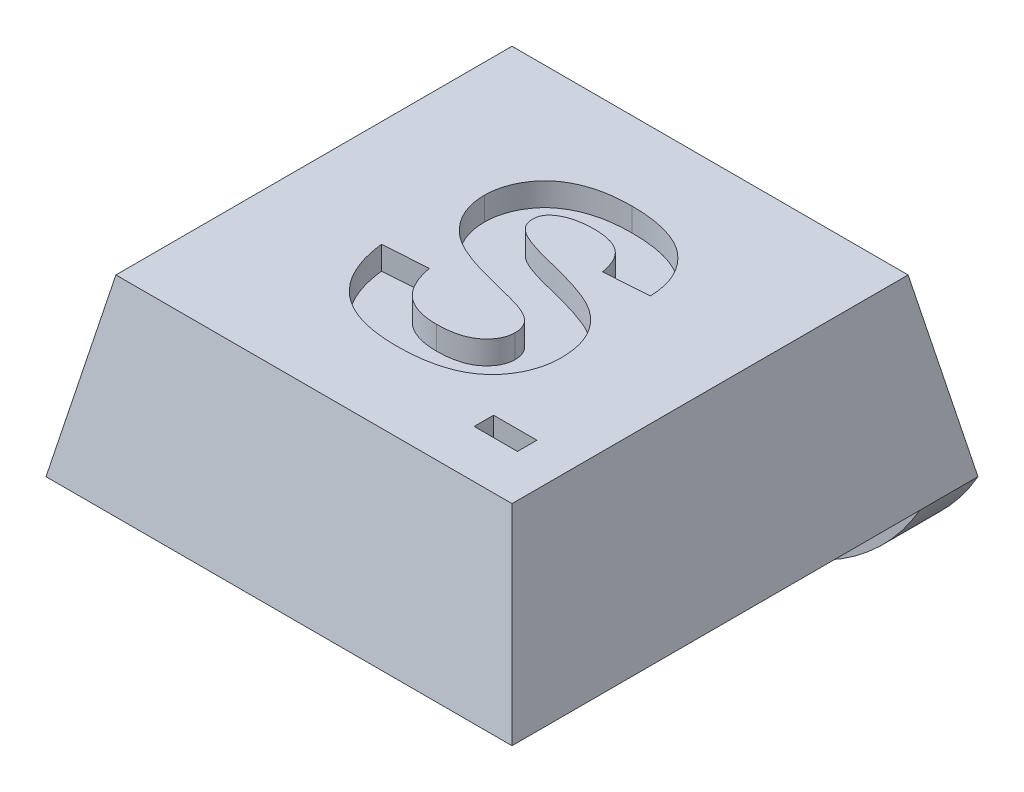
from build123d import *

# Parameters (mm, degrees)
SKETCH1_W               = 8
SKETCH1_H               = 8
BOSS_EXTRUDE1_DEPTH     = 3
CUT_EXTRUDE1_DEPTH      = 12.704699911
CUT_EXTRUDE1_DEPTH_BACK = 12.704699911
CUT_EXTRUDE2_DEPTH      = 11
SKETCH4_R               = 1.8
CUT_EXTRUDE3_DEPTH      = 0.8
SKETCH5_W               = 8
SKETCH5_H               = 1
BOSS_EXTRUDE2_DEPTH     = 2
FILLET1_R               = 4
CUT_EXTRUDE4_DEPTH      = 0.4
SKETCH7_W               = 0.743589743
SKETCH7_H               = 0.333333333
CUT_EXTRUDE5_DEPTH      = 0.4


with BuildPart() as part:
    # Sketch1 → Boss-Extrude1 (new body)
    with BuildSketch(Plane(origin=(0, 0, 0), x_dir=(1, 0, 0), z_dir=(0, 1, 0))):
        with Locations((4, 4)):
            Rectangle(SKETCH1_W, SKETCH1_H)
    extrude(amount=BOSS_EXTRUDE1_DEPTH)

    # Sketch2 → Cut-Extrude1 (cut, two sides: drawn at the far end of the back side and taken through both)
    with BuildSketch(Plane.XY.offset(-CUT_EXTRUDE1_DEPTH_BACK)):
        Polygon((0, 0), (0.6, 3), (0, 3), align=None)
        Polygon((8, 0), (7.4, 3), (8, 3), align=None)
    extrude(amount=CUT_EXTRUDE1_DEPTH + CUT_EXTRUDE1_DEPTH_BACK, mode=Mode.SUBTRACT)

    # Sketch3 → Cut-Extrude2 (cut)
    with BuildSketch(Plane(origin=(0, 0, 0), x_dir=(0, 0, -1), z_dir=(1, 0, 0))):
        Polygon((0, 0), (0.6, 3), (0, 3), align=None)
        Polygon((8, 3), (7.4, 3), (8, 0), align=None)
    extrude(amount=CUT_EXTRUDE2_DEPTH, mode=Mode.SUBTRACT)

    # Sketch4 → Cut-Extrude3 (cut)
    with BuildSketch(Plane.XZ):
        with Locations(Location((4, -3.75, 0), (0, 0, 270))):
            Circle(SKETCH4_R)
    extrude(amount=-CUT_EXTRUDE3_DEPTH, mode=Mode.SUBTRACT)

    # Sketch5 → Boss-Extrude2 (add)
    with BuildSketch(Plane.XZ):
        with Locations((4, -7.5)):
            Rectangle(SKETCH5_W, SKETCH5_H)
    extrude(amount=BOSS_EXTRUDE2_DEPTH)

    # Fillet1
    # the kernel refuses this fillet: 4 mm, written as the material it takes off along each edge
    with BuildSketch(Plane(origin=(8, -2, -16.660254038), x_dir=(0, 1, 0), z_dir=(0, 0, 1)), Plane(origin=(0, -2, 1.660254038), x_dir=(0, 1, 0), z_dir=(0, 0, -1))) as fillet1_piece_1:
        with BuildLine():
            CenterArc((4, 3.464101615), FILLET1_R, 180, 60)
            Line((0, 3.464101615), (-0.08, 3.464101615))
            Line((-0.08, 3.464101615), (-0.08, 0))
            Line((-0.08, 0), (0, -0.08))
            ThreePointArc((0, -0.08), (1, -0.08), (1.96, -0.069282032))
            Line((1.96, -0.069282032), (2, 0))
        make_face()
    extrude(amount=18.320508076, mode=Mode.SUBTRACT)

    # Sketch6 → Cut-Extrude4 (cut)
    with BuildSketch(Plane(origin=(0, 3, 0), x_dir=(1, 0, 0), z_dir=(0, 1, 0))):
        with BuildLine():
            Line((2.423916505, 3.336189685), (3.193147274, 3.387471736))
            add(Edge.make_bspline(
                [(3.193147274, 3.387471736), (3.199275518, 3.35528983), (3.211179242, 3.292778523), (3.237627081, 3.203691377), (3.266738832, 3.12063689), (3.30152897, 3.044505684), (3.339615284, 2.973890515), (3.38412658, 2.910803039), (3.431957638, 2.853229033), (3.485476185, 2.803236311), (3.543783948, 2.759451994), (3.607171876, 2.722111271), (3.674953108, 2.6897922), (3.747293374, 2.663178469), (3.824938253, 2.64331119), (3.907211345, 2.629176798), (3.994230643, 2.620125524), (4.053701404, 2.618879435), (4.084172915, 2.618240967)],
                knots=[0, 0, 0, 0, 1.204560339, 2.339781841, 3.415289417, 4.440034832, 5.416475564, 6.362424008, 7.275913008, 8.16578645, 9.05021719, 9.95355393, 10.867835453, 11.809845306, 12.784702352, 13.812224031, 14.87903166, 16, 16, 16, 16], degree=3))
            add(Edge.make_bspline(
                [(4.084172915, 2.618240967), (4.116246108, 2.618590883), (4.178630121, 2.619271489), (4.269031453, 2.627715), (4.353560804, 2.639811238), (4.431471751, 2.6589593), (4.504219207, 2.680373377), (4.569996427, 2.709670116), (4.629867843, 2.743459668), (4.683679212, 2.781802056), (4.730640445, 2.824326515), (4.771724475, 2.86872067), (4.807505951, 2.914025405), (4.835668504, 2.962251146), (4.858460082, 3.011447443), (4.873523718, 3.063081907), (4.883700097, 3.1159689), (4.884867031, 3.152113555), (4.885454967, 3.1703243)],
                knots=[0, 0, 0, 0, 1.417779877, 2.757654889, 4.012140507, 5.189587551, 6.302846416, 7.360586765, 8.365575446, 9.33904572, 10.275781718, 11.161696098, 12.012180333, 12.822428111, 13.625933072, 14.403138519, 15.195454004, 16, 16, 16, 16], degree=3))
            add(Edge.make_bspline(
                [(4.885454967, 3.1703243), (4.884733913, 3.193140887), (4.883323278, 3.237778199), (4.866340641, 3.301592127), (4.840872442, 3.360713887), (4.802526135, 3.41427025), (4.750979261, 3.463212961), (4.685226085, 3.508997669), (4.603431212, 3.550186), (4.542750055, 3.573160928), (4.510454967, 3.585388403)],
                knots=[0, 0, 0, 0, 0.90494901, 1.770400303, 2.607161909, 3.452839393, 4.36912122, 5.420987164, 6.627424851, 8, 8, 8, 8], degree=3))
            add(Edge.make_bspline(
                [(4.510454967, 3.585388403), (4.496597999, 3.590031937), (4.465588357, 3.600423411), (4.4126892, 3.615282239), (4.348970759, 3.633836968), (4.273512264, 3.654927379), (4.186339087, 3.676497317), (4.088424838, 3.703069034), (3.978575834, 3.729510064), (3.901725338, 3.749028827), (3.861416505, 3.759266608)],
                knots=[0, 0, 0, 0, 0.521821638, 1.167752076, 1.961721917, 2.891982557, 3.96540661, 5.168436773, 6.514817513, 8, 8, 8, 8], degree=3))
            add(Edge.make_bspline(
                [(3.861416505, 3.759266608), (3.808922441, 3.772373151), (3.707643728, 3.797660082), (3.563197092, 3.84264374), (3.430159098, 3.887337495), (3.309810688, 3.935832618), (3.200824367, 3.984842463), (3.104963023, 4.037807847), (3.02022624, 4.091978089), (2.970848149, 4.132466251), (2.947153685, 4.151894813)],
                knots=[0, 0, 0, 0, 1.293880989, 2.496331788, 3.617634808, 4.64976062, 5.598842568, 6.473791081, 7.267636666, 8, 8, 8, 8], degree=3))
            add(Edge.make_bspline(
                [(2.947153685, 4.151894813), (2.917769469, 4.179407128), (2.860158996, 4.233347566), (2.784323751, 4.321982057), (2.720601495, 4.415610216), (2.668151102, 4.513540942), (2.627765291, 4.616338017), (2.599140348, 4.723313361), (2.580613245, 4.834746169), (2.578722682, 4.91063455), (2.577762659, 4.949170454)],
                knots=[0, 0, 0, 0, 1.064429417, 2.086912298, 3.078678339, 4.055528992, 5.020032834, 5.993708893, 6.981211098, 8, 8, 8, 8], degree=3))
            add(Edge.make_bspline(
                [(2.577762659, 4.949170454), (2.579632311, 4.999035454), (2.583341142, 5.097952729), (2.617353538, 5.24334762), (2.670335558, 5.383642492), (2.731782138, 5.495041815), (2.790819043, 5.579315825), (2.839844896, 5.639790083), (2.893704531, 5.696388175), (2.953135712, 5.747729494), (3.015931612, 5.796821395), (3.084525186, 5.840415592), (3.156971597, 5.881478913), (3.261809808, 5.93015757), (3.404151332, 5.980885512), (3.589345301, 6.023645948), (3.790984862, 6.049350493), (3.930782191, 6.052503897), (4.003243428, 6.054138403)],
                knots=[0, 0, 0, 0, 1.180131776, 2.341029169, 3.518901375, 4.725685298, 5.343762192, 5.955650671, 6.568945152, 7.192346361, 7.815201106, 8.455999361, 9.116257477, 9.787318263, 11.192748436, 12.688084276, 14.283332633, 16, 16, 16, 16], degree=3))
            add(Edge.make_bspline(
                [(4.003243428, 6.054138403), (4.062574751, 6.053344994), (4.177972905, 6.051801831), (4.345255933, 6.036197125), (4.501507358, 6.011910245), (4.646178875, 5.977046542), (4.779337891, 5.930982439), (4.901500568, 5.876111383), (5.012563098, 5.81096567), (5.111173405, 5.735171454), (5.199025737, 5.651613191), (5.275662846, 5.560343317), (5.341377732, 5.462514514), (5.396594511, 5.358198276), (5.439956101, 5.246858263), (5.471803478, 5.128633406), (5.492867609, 5.003801978), (5.498147397, 4.918266237), (5.500839582, 4.874651223)],
                knots=[0, 0, 0, 0, 1.325124071, 2.577337985, 3.749592149, 4.855247722, 5.896868755, 6.892903601, 7.842551483, 8.766257401, 9.665194363, 10.546067736, 11.423174165, 12.293291263, 13.177512979, 14.086532529, 15.024315359, 16, 16, 16, 16], degree=3))
            Line((5.500839582, 4.874651223), (4.731608813, 4.823369172))
            add(Edge.make_bspline(
                [(4.731608813, 4.823369172), (4.727171315, 4.847490186), (4.718523093, 4.894499533), (4.699719489, 4.96182647), (4.678509937, 5.024096207), (4.653685255, 5.081308344), (4.623700039, 5.13243816), (4.591067506, 5.179094223), (4.554887475, 5.220654869), (4.51396201, 5.255982033), (4.469697485, 5.288128305), (4.419251527, 5.313894286), (4.364737876, 5.337799444), (4.30408262, 5.355770261), (4.238450559, 5.370025359), (4.167803464, 5.380593162), (4.091994892, 5.385752959), (4.039841388, 5.386885694), (4.012858813, 5.387471736)],
                knots=[0, 0, 0, 0, 1.151066407, 2.24330871, 3.278475654, 4.238599069, 5.165719782, 6.056502506, 6.909492653, 7.744782051, 8.590364415, 9.471203867, 10.39832458, 11.382154319, 12.435022857, 13.550631277, 14.73277401, 16, 16, 16, 16], degree=3))
            add(Edge.make_bspline(
                [(4.012858813, 5.387471736), (3.984804304, 5.386954358), (3.930223002, 5.385947775), (3.850683499, 5.379770524), (3.776069477, 5.368367912), (3.706014485, 5.353524542), (3.640612102, 5.333331162), (3.580000346, 5.308708643), (3.523901913, 5.279720359), (3.489695535, 5.256913378), (3.47279471, 5.245644813)],
                knots=[0, 0, 0, 0, 1.186678824, 2.308736671, 3.37120409, 4.377216403, 5.334874112, 6.262130804, 7.141346615, 8, 8, 8, 8], degree=3))
            add(Edge.make_bspline(
                [(3.47279471, 5.245644813), (3.453453136, 5.230251633), (3.415994509, 5.200439822), (3.3756811, 5.141243702), (3.351412335, 5.074383458), (3.348491314, 5.027102037), (3.346993428, 5.002856352)],
                knots=[0, 0, 0, 0, 1.037857257, 2.010007357, 2.979541333, 4, 4, 4, 4], degree=3))
            add(Edge.make_bspline(
                [(3.346993428, 5.002856352), (3.348218426, 4.980197149), (3.350631475, 4.935562125), (3.374970191, 4.872157107), (3.41239982, 4.813407798), (3.447371668, 4.781494404), (3.465583172, 4.764875582)],
                knots=[0, 0, 0, 0, 0.98538058, 1.941042925, 2.927803204, 4, 4, 4, 4], degree=3))
            add(Edge.make_bspline(
                [(3.465583172, 4.764875582), (3.480036346, 4.754089134), (3.512333176, 4.72998591), (3.571494566, 4.699348433), (3.642903916, 4.666166195), (3.728189187, 4.633726893), (3.826783574, 4.601347807), (3.938693075, 4.567540299), (4.063986517, 4.533278892), (4.199470233, 4.500098399), (4.337024364, 4.467483879), (4.46828848, 4.431827004), (4.590345232, 4.397064309), (4.702628677, 4.360627363), (4.805717615, 4.325156109), (4.899111277, 4.288724577), (4.98345094, 4.253244341), (5.081800337, 4.204456503), (5.193269487, 4.138371404), (5.310101731, 4.042305693), (5.413424942, 3.934321559), (5.485417809, 3.83249997), (5.534873142, 3.744930694), (5.566717158, 3.675127784), (5.59426473, 3.601573118), (5.616688379, 3.524185412), (5.632940128, 3.442855773), (5.646389397, 3.358205559), (5.653260877, 3.269531733), (5.654205671, 3.209062493), (5.654685736, 3.178337121)],
                knots=[0, 0, 0, 0, 0.511875881, 1.143829537, 1.88775736, 2.750598373, 3.734912702, 4.837306479, 6.073130119, 7.42648979, 8.801963576, 10.091065733, 11.292408984, 12.408830014, 13.446061236, 14.39066453, 15.257936293, 16.045629259, 17.510392066, 18.929669597, 20.331293837, 21.746891395, 22.460690638, 23.187651344, 23.925159671, 24.69163991, 25.474819891, 26.281170188, 27.126635539, 28, 28, 28, 28], degree=3))
            add(Edge.make_bspline(
                [(5.654685736, 3.178337121), (5.654025632, 3.150001459), (5.652714728, 3.093729578), (5.643553782, 3.010207902), (5.629386607, 2.928169417), (5.608414322, 2.847511277), (5.580592445, 2.768392154), (5.549267222, 2.689670139), (5.510096795, 2.613061996), (5.465515506, 2.538504273), (5.41634032, 2.466052922), (5.360615699, 2.3992182), (5.301614691, 2.335770341), (5.235567289, 2.279262071), (5.166552067, 2.225117883), (5.091412341, 2.177166881), (5.011908526, 2.133775469), (4.927537931, 2.095267608), (4.838001417, 2.061711489), (4.743415274, 2.031844209), (4.642927337, 2.007400135), (4.537375532, 1.986448484), (4.426373586, 1.970515295), (4.310060277, 1.959390224), (4.188409162, 1.953116354), (4.105547428, 1.952094705), (4.063339582, 1.9515743)],
                knots=[0, 0, 0, 0, 0.900570041, 1.788444861, 2.667795364, 3.545012114, 4.433698372, 5.332345486, 6.235991676, 7.164928091, 8.092777575, 9.015680987, 9.928493428, 10.842962589, 11.775229507, 12.714851019, 13.672254427, 14.652424454, 15.660007982, 16.709910502, 17.803296389, 18.945495772, 20.129342395, 21.366102753, 22.658353839, 24, 24, 24, 24], degree=3))
            add(Edge.make_bspline(
                [(4.063339582, 1.9515743), (4.002397965, 1.952569276), (3.883743193, 1.954506517), (3.711359118, 1.971846347), (3.549674268, 1.998386209), (3.398951853, 2.0369045), (3.259007654, 2.086353292), (3.129905498, 2.147263285), (3.012269836, 2.219998383), (2.90464369, 2.302794639), (2.808461007, 2.397160809), (2.721973345, 2.501141662), (2.646347447, 2.615673526), (2.58163302, 2.740577261), (2.526193974, 2.875177636), (2.480472858, 3.01953646), (2.446047261, 3.174342245), (2.431421007, 3.281307488), (2.423916505, 3.336189685)],
                knots=[0, 0, 0, 0, 1.217954099, 2.371385517, 3.459848295, 4.490682126, 5.476952527, 6.422732854, 7.338496285, 8.236688651, 9.131557988, 10.026443255, 10.935708282, 11.869506048, 12.834296687, 13.842423496, 14.892981177, 16, 16, 16, 16], degree=3))
        make_face()
    extrude(amount=-CUT_EXTRUDE4_DEPTH, mode=Mode.SUBTRACT)

    # Sketch7 → Cut-Extrude5 (cut)
    with BuildSketch(Plane(origin=(0, 3, 0), x_dir=(1, 0, 0), z_dir=(0, 1, 0))):
        with Locations((6.299141853, 1.589907949)):
            Rectangle(SKETCH7_W, SKETCH7_H)
    extrude(amount=-CUT_EXTRUDE5_DEPTH, mode=Mode.SUBTRACT)


solid = part.part
